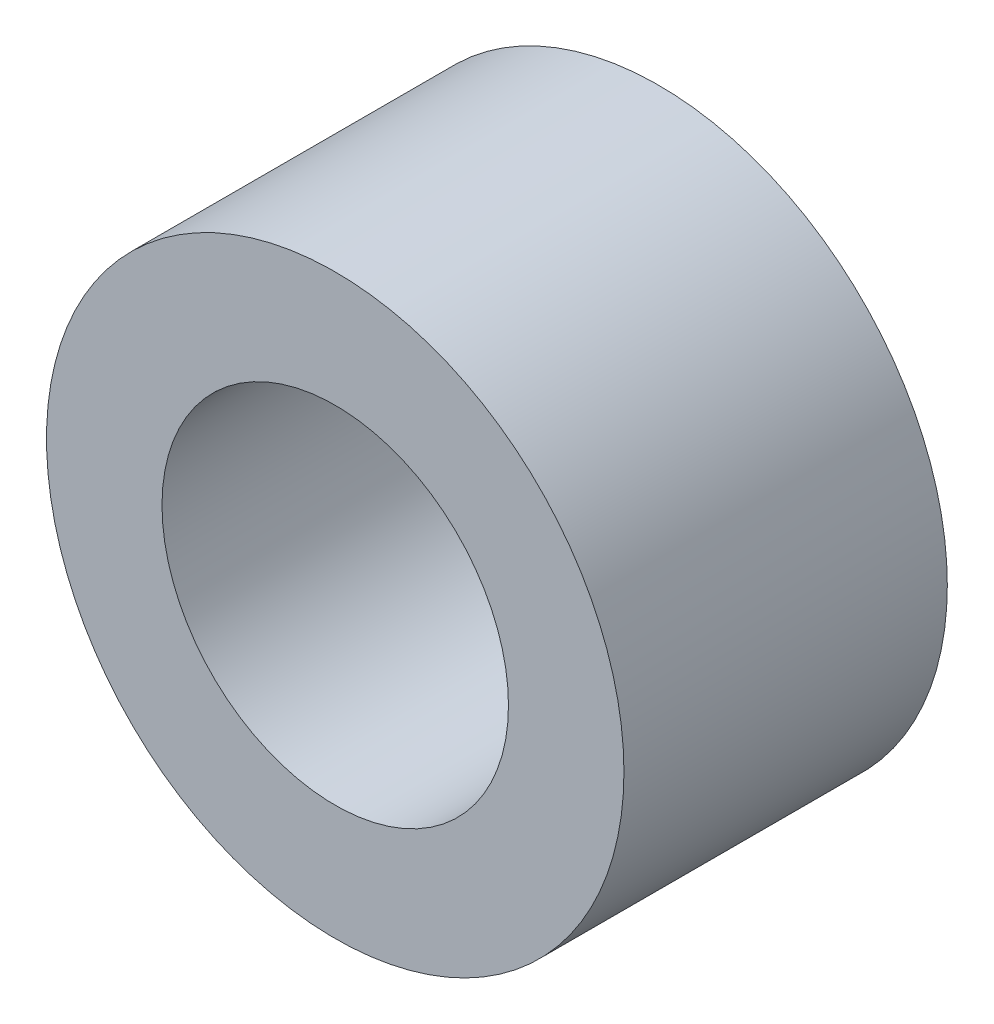
from build123d import *

# Parameters (mm, degrees)
SKETCH_1_R      = 2.5
SKETCH_1_R_2    = 1.5
EXTRUDE_1_DEPTH = 2.8


with BuildPart() as part:
    # 草图1 → 凸台-拉伸1 (new body)
    with BuildSketch(Plane.XY):
        Circle(SKETCH_1_R)
        Circle(SKETCH_1_R_2, mode=Mode.SUBTRACT)
    extrude(amount=EXTRUDE_1_DEPTH)


solid = part.part
